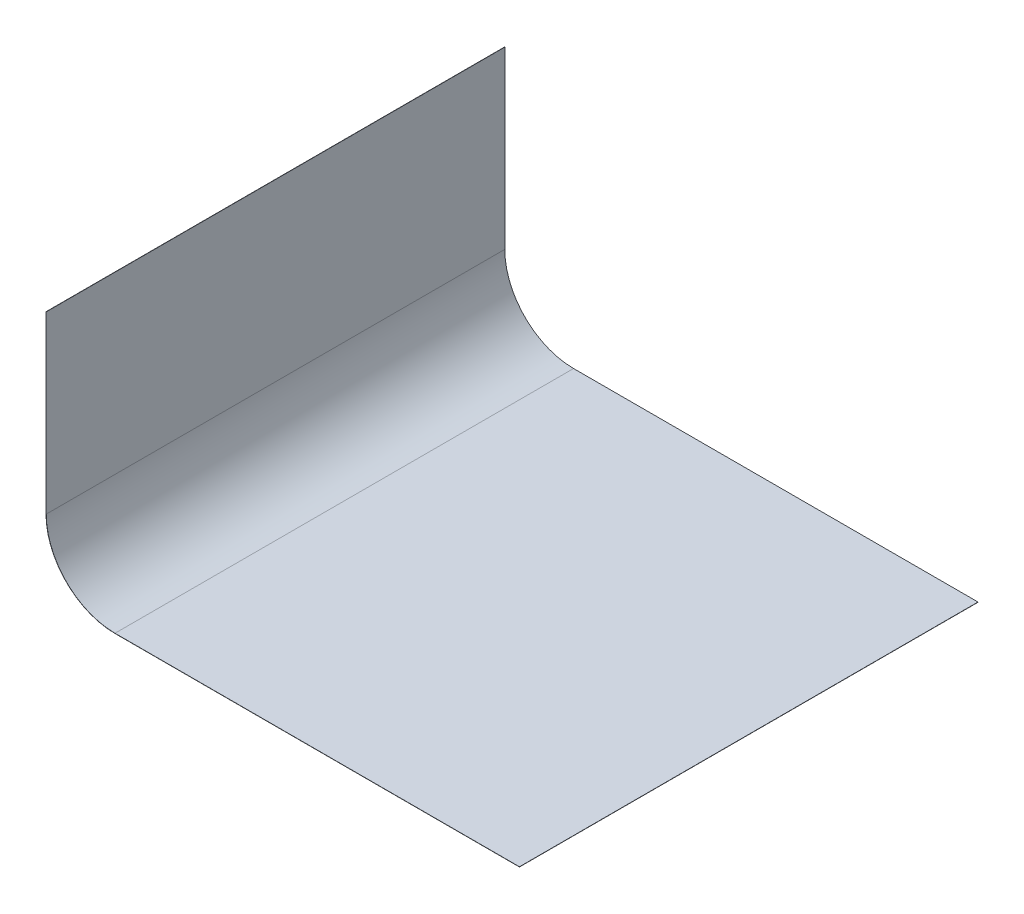
from build123d import *

# Parameters (mm, degrees)
SKETCH1_W              = 30
SKETCH1_H              = 20
BASE_FLANGE1_DEPTH     = 0.01
SKETCHED_START         = -6.262135922
SKETCHED_BEND1_DEPTH   = 20
SKETCHED_BEND1_2_DEPTH = 20


# Read off the part's stored shape, not the designer's step: Sketched Bend1
# Sheet-metal steps are written as plain solids
with BuildPart() as part:
    # Sketch1 → Base-Flange1 (new body)
    with BuildSketch(Plane(origin=(0, 0, 0), x_dir=(1, 0, 0), z_dir=(0, 1, 0))):
        with Locations((2.366504854, -3.737864078)):
            Rectangle(SKETCH1_W, SKETCH1_H)
    extrude(amount=-BASE_FLANGE1_DEPTH)

    # Sketched Bend1 outline → Sketched Bend1 (cut)
    with BuildSketch(Plane.XY.offset(SKETCHED_START)):
        with BuildLine():
            ThreePointArc((-0.273373665, -0.01), (-0.396052106, -0.007498961), (-0.518526677, 0))
            Line((-0.518526677, 0), (-12.633495146, 0))
            Line((-12.633495146, 0), (-12.633495146, -0.01))
            Line((-12.633495146, -0.01), (-0.273373665, -0.01))
        make_face()
    extrude(amount=SKETCHED_BEND1_DEPTH, mode=Mode.SUBTRACT)

    # Sketched Bend1 2 outline → Sketched Bend1 2 (add)
    with BuildSketch(Plane.XY.offset(SKETCHED_START)):
        with BuildLine():
            ThreePointArc((-0.273373665, 0), (-2.394694009, 0.878679657), (-3.273373665, 3))
            Line((-3.273373665, 3), (-3.273373665, 10.639878519))
            Line((-3.273373665, 10.639878519), (-3.283373665, 10.639878519))
            Line((-3.283373665, 10.639878519), (-3.283373665, 3))
            ThreePointArc((-3.283373665, 3), (-2.486743332, 0.960123848), (-0.518526677, 0))
            Line((-0.518526677, 0), (-0.273373665, 0))
        make_face()
    extrude(amount=SKETCHED_BEND1_2_DEPTH)


solid = part.part
